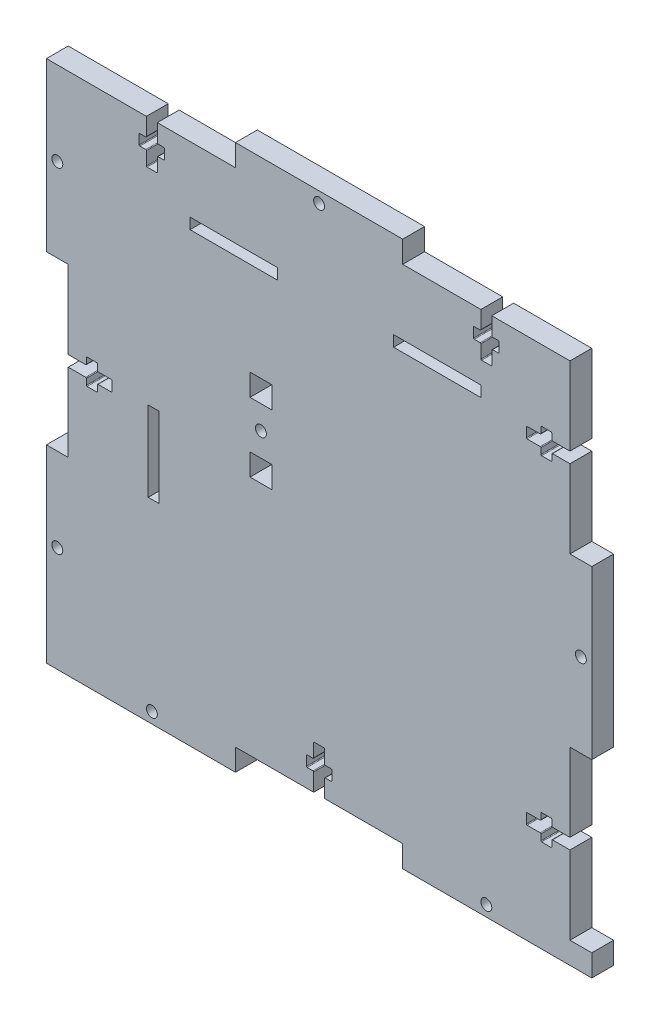
from build123d import *

# Parameters (mm, degrees)
BOX_SIDE_DEPTH       = 6
SKETCH2_R            = 1.5
SCREW_CUT_OUTS_DEPTH = 107.235587258
SKETCH3_R            = 1.5
SKETCH3_W            = 24
SKETCH3_H            = 3
SKETCH3_W_2          = 6
SKETCH3_H_2          = 6
SKETCH3_W_3          = 3
SKETCH3_H_3          = 22
GROOVES_DEPTH        = 107.235587258
SKETCH4_W            = 6
SKETCH4_H            = 6
BOSS_EXTRUDE1_DEPTH  = 6


with BuildPart() as part:
    # Sketch1 → Box Side (new body)
    with BuildSketch(Plane.XY):
        Polygon((-69, 69), (-23, 69), (-23, 75), (23, 75), (23, 69), (69, 69), (69, 23), (75, 23), (75, -23), (69, -23), (69, -69), (69, -75), (23, -75), (23, -69), (-23, -69), (-23, -75), (-69, -75), (-75, -75), (-75, -69), (-75, -23), (-69, -23), (-69, 23), (-75, 23), (-75, 69), align=None)
    extrude(amount=BOX_SIDE_DEPTH)

    # Sketch2 → Screw Cut-outs (cut, through all)
    with BuildSketch(Plane.XY.offset(6)):
        with Locations((0, 72)):
            Circle(SKETCH2_R)
        with Locations((72, 0)):
            Circle(SKETCH2_R)
        with Locations((-46, -72)):
            Circle(SKETCH2_R)
        with Locations((46, -72)):
            Circle(SKETCH2_R)
        with Locations((-72, 46)):
            Circle(SKETCH2_R)
        with Locations((-72, -46)):
            Circle(SKETCH2_R)
        with BuildLine():
            Line((-44.5, 69), (-44.5, 64.2))
            ThreePointArc((-44.5, 64.2), (-44.441421356, 64.058578644), (-44.3, 64))
            Line((-44.3, 64), (-42.7, 64))
            ThreePointArc((-42.7, 64), (-42.558578644, 63.941421356), (-42.5, 63.8))
            Line((-42.5, 63.8), (-42.5, 61.2))
            ThreePointArc((-42.5, 61.2), (-42.558578644, 61.058578644), (-42.7, 61))
            Line((-42.7, 61), (-44.3, 61))
            ThreePointArc((-44.3, 61), (-44.441421356, 60.941421356), (-44.5, 60.8))
            Line((-44.5, 60.8), (-44.5, 57.2))
            ThreePointArc((-44.5, 57.2), (-44.558578644, 57.058578644), (-44.7, 57))
            Line((-44.7, 57), (-47.3, 57))
            ThreePointArc((-47.3, 57), (-47.441421356, 57.058578644), (-47.5, 57.2))
            Line((-47.5, 57.2), (-47.5, 60.8))
            ThreePointArc((-47.5, 60.8), (-47.558578644, 60.941421356), (-47.7, 61))
            Line((-47.7, 61), (-49.3, 61))
            ThreePointArc((-49.3, 61), (-49.441421356, 61.058578644), (-49.5, 61.2))
            Line((-49.5, 61.2), (-49.5, 63.8))
            ThreePointArc((-49.5, 63.8), (-49.441421356, 63.941421356), (-49.3, 64))
            Line((-49.3, 64), (-47.7, 64))
            ThreePointArc((-47.7, 64), (-47.558578644, 64.058578644), (-47.5, 64.2))
            Line((-47.5, 64.2), (-47.5, 69))
            Line((-47.5, 69), (-44.5, 69))
        make_face()
        with BuildLine():
            Line((47.5, 69), (47.5, 64.2))
            ThreePointArc((47.5, 64.2), (47.558578644, 64.058578644), (47.7, 64))
            Line((47.7, 64), (49.3, 64))
            ThreePointArc((49.3, 64), (49.441421356, 63.941421356), (49.5, 63.8))
            Line((49.5, 63.8), (49.5, 61.2))
            ThreePointArc((49.5, 61.2), (49.441421356, 61.058578644), (49.3, 61))
            Line((49.3, 61), (47.7, 61))
            ThreePointArc((47.7, 61), (47.558578644, 60.941421356), (47.5, 60.8))
            Line((47.5, 60.8), (47.5, 57.2))
            ThreePointArc((47.5, 57.2), (47.441421356, 57.058578644), (47.3, 57))
            Line((47.3, 57), (44.7, 57))
            ThreePointArc((44.7, 57), (44.558578644, 57.058578644), (44.5, 57.2))
            Line((44.5, 57.2), (44.5, 60.8))
            ThreePointArc((44.5, 60.8), (44.441421356, 60.941421356), (44.3, 61))
            Line((44.3, 61), (42.7, 61))
            ThreePointArc((42.7, 61), (42.558578644, 61.058578644), (42.5, 61.2))
            Line((42.5, 61.2), (42.5, 63.8))
            ThreePointArc((42.5, 63.8), (42.558578644, 63.941421356), (42.7, 64))
            Line((42.7, 64), (44.3, 64))
            ThreePointArc((44.3, 64), (44.441421356, 64.058578644), (44.5, 64.2))
            Line((44.5, 64.2), (44.5, 69))
            Line((44.5, 69), (47.5, 69))
        make_face()
        with BuildLine():
            Line((69, 44.5), (64.2, 44.5))
            ThreePointArc((64.2, 44.5), (64.058578644, 44.441421356), (64, 44.3))
            Line((64, 44.3), (64, 42.7))
            ThreePointArc((64, 42.7), (63.941421356, 42.558578644), (63.8, 42.5))
            Line((63.8, 42.5), (61.2, 42.5))
            ThreePointArc((61.2, 42.5), (61.058578644, 42.558578644), (61, 42.7))
            Line((61, 42.7), (61, 44.3))
            ThreePointArc((61, 44.3), (60.941421356, 44.441421356), (60.8, 44.5))
            Line((60.8, 44.5), (57.2, 44.5))
            ThreePointArc((57.2, 44.5), (57.058578644, 44.558578644), (57, 44.7))
            Line((57, 44.7), (57, 47.3))
            ThreePointArc((57, 47.3), (57.058578644, 47.441421356), (57.2, 47.5))
            Line((57.2, 47.5), (60.8, 47.5))
            ThreePointArc((60.8, 47.5), (60.941421356, 47.558578644), (61, 47.7))
            Line((61, 47.7), (61, 49.3))
            ThreePointArc((61, 49.3), (61.058578644, 49.441421356), (61.2, 49.5))
            Line((61.2, 49.5), (63.8, 49.5))
            ThreePointArc((63.8, 49.5), (63.941421356, 49.441421356), (64, 49.3))
            Line((64, 49.3), (64, 47.7))
            ThreePointArc((64, 47.7), (64.058578644, 47.558578644), (64.2, 47.5))
            Line((64.2, 47.5), (69, 47.5))
            Line((69, 47.5), (69, 44.5))
        make_face()
        with BuildLine():
            Line((69, -47.5), (64.2, -47.5))
            ThreePointArc((64.2, -47.5), (64.058578644, -47.558578644), (64, -47.7))
            Line((64, -47.7), (64, -49.3))
            ThreePointArc((64, -49.3), (63.941421356, -49.441421356), (63.8, -49.5))
            Line((63.8, -49.5), (61.2, -49.5))
            ThreePointArc((61.2, -49.5), (61.058578644, -49.441421356), (61, -49.3))
            Line((61, -49.3), (61, -47.7))
            ThreePointArc((61, -47.7), (60.941421356, -47.558578644), (60.8, -47.5))
            Line((60.8, -47.5), (57.2, -47.5))
            ThreePointArc((57.2, -47.5), (57.058578644, -47.441421356), (57, -47.3))
            Line((57, -47.3), (57, -44.7))
            ThreePointArc((57, -44.7), (57.058578644, -44.558578644), (57.2, -44.5))
            Line((57.2, -44.5), (60.8, -44.5))
            ThreePointArc((60.8, -44.5), (60.941421356, -44.441421356), (61, -44.3))
            Line((61, -44.3), (61, -42.7))
            ThreePointArc((61, -42.7), (61.058578644, -42.558578644), (61.2, -42.5))
            Line((61.2, -42.5), (63.8, -42.5))
            ThreePointArc((63.8, -42.5), (63.941421356, -42.558578644), (64, -42.7))
            Line((64, -42.7), (64, -44.3))
            ThreePointArc((64, -44.3), (64.058578644, -44.441421356), (64.2, -44.5))
            Line((64.2, -44.5), (69, -44.5))
            Line((69, -44.5), (69, -47.5))
        make_face()
        with BuildLine():
            Line((-1.5, -69), (1.5, -69))
            Line((1.5, -69), (1.5, -64.2))
            ThreePointArc((1.5, -64.2), (1.558578644, -64.058578644), (1.7, -64))
            Line((1.7, -64), (3.3, -64))
            ThreePointArc((3.3, -64), (3.441421356, -63.941421356), (3.5, -63.8))
            Line((3.5, -63.8), (3.5, -61.2))
            ThreePointArc((3.5, -61.2), (3.441421356, -61.058578644), (3.3, -61))
            Line((3.3, -61), (1.7, -61))
            ThreePointArc((1.7, -61), (1.558578644, -60.941421356), (1.5, -60.8))
            Line((1.5, -60.8), (1.5, -57.2))
            ThreePointArc((1.5, -57.2), (1.441421356, -57.058578644), (1.3, -57))
            Line((1.3, -57), (-1.3, -57))
            ThreePointArc((-1.3, -57), (-1.441421356, -57.058578644), (-1.5, -57.2))
            Line((-1.5, -57.2), (-1.5, -60.8))
            ThreePointArc((-1.5, -60.8), (-1.558578644, -60.941421356), (-1.7, -61))
            Line((-1.7, -61), (-3.3, -61))
            ThreePointArc((-3.3, -61), (-3.441421356, -61.058578644), (-3.5, -61.2))
            Line((-3.5, -61.2), (-3.5, -63.8))
            ThreePointArc((-3.5, -63.8), (-3.441421356, -63.941421356), (-3.3, -64))
            Line((-3.3, -64), (-1.7, -64))
            ThreePointArc((-1.7, -64), (-1.558578644, -64.058578644), (-1.5, -64.2))
            Line((-1.5, -64.2), (-1.5, -69))
        make_face()
        with BuildLine():
            Line((-69, -1.5), (-64.2, -1.5))
            ThreePointArc((-64.2, -1.5), (-64.058578644, -1.558578644), (-64, -1.7))
            Line((-64, -1.7), (-64, -3.3))
            ThreePointArc((-64, -3.3), (-63.941421356, -3.441421356), (-63.8, -3.5))
            Line((-63.8, -3.5), (-61.2, -3.5))
            ThreePointArc((-61.2, -3.5), (-61.058578644, -3.441421356), (-61, -3.3))
            Line((-61, -3.3), (-61, -1.7))
            ThreePointArc((-61, -1.7), (-60.941421356, -1.558578644), (-60.8, -1.5))
            Line((-60.8, -1.5), (-57.2, -1.5))
            ThreePointArc((-57.2, -1.5), (-57.058578644, -1.441421356), (-57, -1.3))
            Line((-57, -1.3), (-57, 1.3))
            ThreePointArc((-57, 1.3), (-57.058578644, 1.441421356), (-57.2, 1.5))
            Line((-57.2, 1.5), (-60.8, 1.5))
            ThreePointArc((-60.8, 1.5), (-60.941421356, 1.558578644), (-61, 1.7))
            Line((-61, 1.7), (-61, 3.3))
            ThreePointArc((-61, 3.3), (-61.058578644, 3.441421356), (-61.2, 3.5))
            Line((-61.2, 3.5), (-63.8, 3.5))
            ThreePointArc((-63.8, 3.5), (-63.941421356, 3.441421356), (-64, 3.3))
            Line((-64, 3.3), (-64, 1.7))
            ThreePointArc((-64, 1.7), (-64.058578644, 1.558578644), (-64.2, 1.5))
            Line((-64.2, 1.5), (-69, 1.5))
            Line((-69, 1.5), (-69, -1.5))
        make_face()
    extrude(amount=-SCREW_CUT_OUTS_DEPTH, mode=Mode.SUBTRACT)

    # Sketch3 → Grooves (cut, through all)
    with BuildSketch(Plane.XY.offset(6)):
        with Locations((-16, 9.82)):
            Circle(SKETCH3_R)
        with Locations((32.5, 49.5)):
            Rectangle(SKETCH3_W, SKETCH3_H)
        with Locations((-16, 19.32)):
            Rectangle(SKETCH3_W_2, SKETCH3_H_2)
        with Locations((-16, 0.32)):
            Rectangle(SKETCH3_W_2, SKETCH3_H_2)
        with Locations((-23.5, 49.5)):
            Rectangle(SKETCH3_W, SKETCH3_H)
        with Locations((-45.5, -10.5)):
            Rectangle(SKETCH3_W_3, SKETCH3_H_3)
    extrude(amount=-GROOVES_DEPTH, mode=Mode.SUBTRACT)

    # Sketch4 → Boss-Extrude1 (add)
    with BuildSketch(Plane(origin=(0, 0, 0), x_dir=(-1, 0, 0), z_dir=(0, 0, -1))):
        with Locations((-72, -72)):
            Rectangle(SKETCH4_W, SKETCH4_H)
    extrude(amount=-BOSS_EXTRUDE1_DEPTH)


solid = part.part
